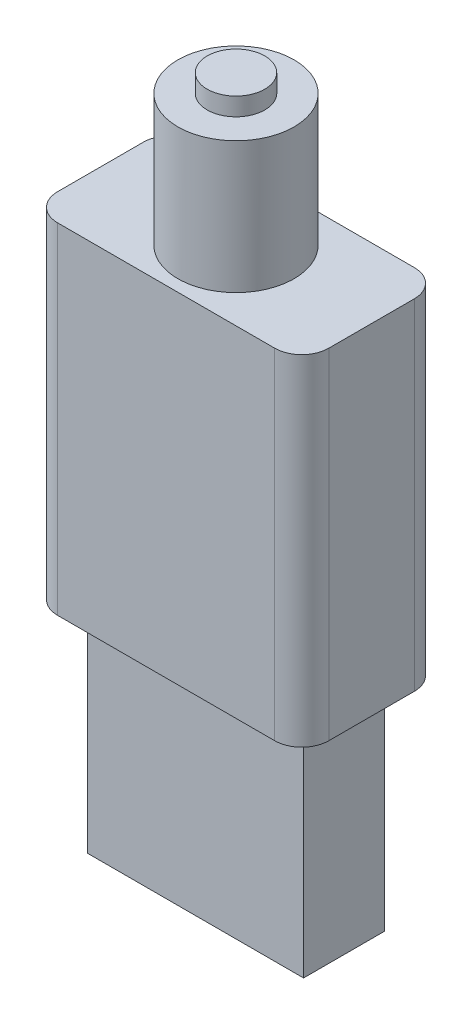
from build123d import *

# Parameters (mm, degrees)
SKETCH1_W           = 12
SKETCH1_H           = 4.5
BOSS_EXTRUDE1_DEPTH = 12.23
BOSS_EXTRUDE2_DEPTH = 18.87
SKETCH3_R           = 3.225
BOSS_EXTRUDE3_DEPTH = 7.3
SKETCH4_R           = 1.6
BOSS_EXTRUDE4_DEPTH = 1


with BuildPart() as part:
    # Sketch1 → Boss-Extrude1 (new body)
    with BuildSketch(Plane(origin=(0, 0, 0), x_dir=(1, 0, 0), z_dir=(0, 1, 0))):
        Rectangle(SKETCH1_W, SKETCH1_H)
    extrude(amount=BOSS_EXTRUDE1_DEPTH)

    # Sketch2 → Boss-Extrude2 (add)
    with BuildSketch(Plane(origin=(0, 12.23, 0), x_dir=(1, 0, 0), z_dir=(0, 1, 0))):
        with BuildLine():
            Line((-6.025, -3.875), (6.025, -3.875))
            ThreePointArc((6.025, -3.875), (7.085660172, -3.435660172), (7.525, -2.375))
            Line((7.525, -2.375), (7.525, 2.375))
            ThreePointArc((7.525, 2.375), (7.085660172, 3.435660172), (6.025, 3.875))
            Line((6.025, 3.875), (-6.025, 3.875))
            ThreePointArc((-6.025, 3.875), (-7.085660172, 3.435660172), (-7.525, 2.375))
            Line((-7.525, 2.375), (-7.525, -2.375))
            ThreePointArc((-7.525, -2.375), (-7.085660172, -3.435660172), (-6.025, -3.875))
        make_face()
    extrude(amount=BOSS_EXTRUDE2_DEPTH)

    # Sketch3 → Boss-Extrude3 (add)
    with BuildSketch(Plane(origin=(0, 31.1, 0), x_dir=(1, 0, 0), z_dir=(0, 1, 0))):
        Circle(SKETCH3_R)
    extrude(amount=BOSS_EXTRUDE3_DEPTH)

    # Sketch4 → Boss-Extrude4 (add)
    with BuildSketch(Plane(origin=(0, 38.4, 0), x_dir=(1, 0, 0), z_dir=(0, 1, 0))):
        Circle(SKETCH4_R)
    extrude(amount=BOSS_EXTRUDE4_DEPTH)


solid = part.part
